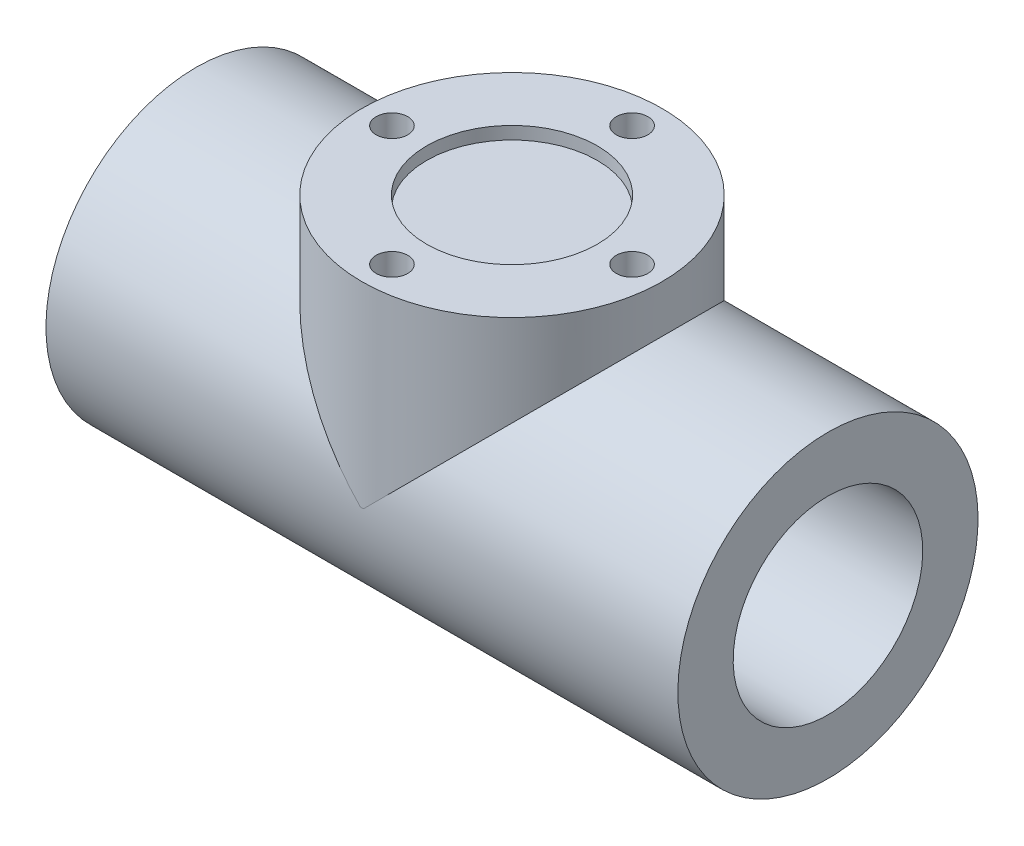
from build123d import *

# Parameters (mm, degrees)
SKETCH1_W           = 200
SKETCH1_H           = 47.5
SKETCH2_R           = 47.5
BOSS_EXTRUDE1_DEPTH = 62
SKETCH3_R           = 27
CUT_EXTRUDE1_DEPTH  = 4
CIRPATTERN1_COUNT   = 4
SKETCH6_R           = 30
CUT_EXTRUDE2_DEPTH  = 215.854601999


with BuildPart() as part:
    # Sketch1 → Revolve1 (revolve)
    with BuildSketch(Plane.XY):
        with Locations((0, 23.75)):
            Rectangle(SKETCH1_W, SKETCH1_H)
    revolve(axis=Axis((100, 0, 0), (-1, 0, 0)))

    # Sketch2 → Boss-Extrude1 (add)
    with BuildSketch(Plane(origin=(0, 62.5, 0), x_dir=(1, 0, 0), z_dir=(0, 1, 0))):
        Circle(SKETCH2_R)
    extrude(amount=-BOSS_EXTRUDE1_DEPTH)

    # Sketch3 → Cut-Extrude1 (cut)
    with BuildSketch(Plane(origin=(0, 62.5, 0), x_dir=(1, 0, 0), z_dir=(0, 1, 0))):
        Circle(SKETCH3_R)
    extrude(amount=-CUT_EXTRUDE1_DEPTH, mode=Mode.SUBTRACT)

    # Sketch5 → Ø1.0mm Dowel Hole1 (revolve, cut)
    with BuildSketch(Plane(origin=(0, 62.5, -38), x_dir=(0, 0, 1), z_dir=(1, 0, 0))):
        Polygon((0, 0), (0, 23.004303095), (5, 20), (5, 0), align=None)
    f_1_0mm_dowel_hole1 = revolve(axis=Axis((0, 68.85, -38), (0, -1, 0)), mode=Mode.SUBTRACT)

    # CirPattern1: Ø1.0mm Dowel Hole1 ×4 about axis
    cirpattern1_axis = Axis((0, 62.5, 0), (0, 1, 0))
    for i in range(1, CIRPATTERN1_COUNT):
        add(f_1_0mm_dowel_hole1.rotate(cirpattern1_axis, i * 360 / CIRPATTERN1_COUNT), mode=Mode.SUBTRACT)

    # Sketch6 → Cut-Extrude2 (cut, through all)
    with BuildSketch(Plane(origin=(100, 0, 0), x_dir=(0, 0, -1), z_dir=(1, 0, 0))):
        Circle(SKETCH6_R)
    extrude(amount=-CUT_EXTRUDE2_DEPTH, mode=Mode.SUBTRACT)


solid = part.part
